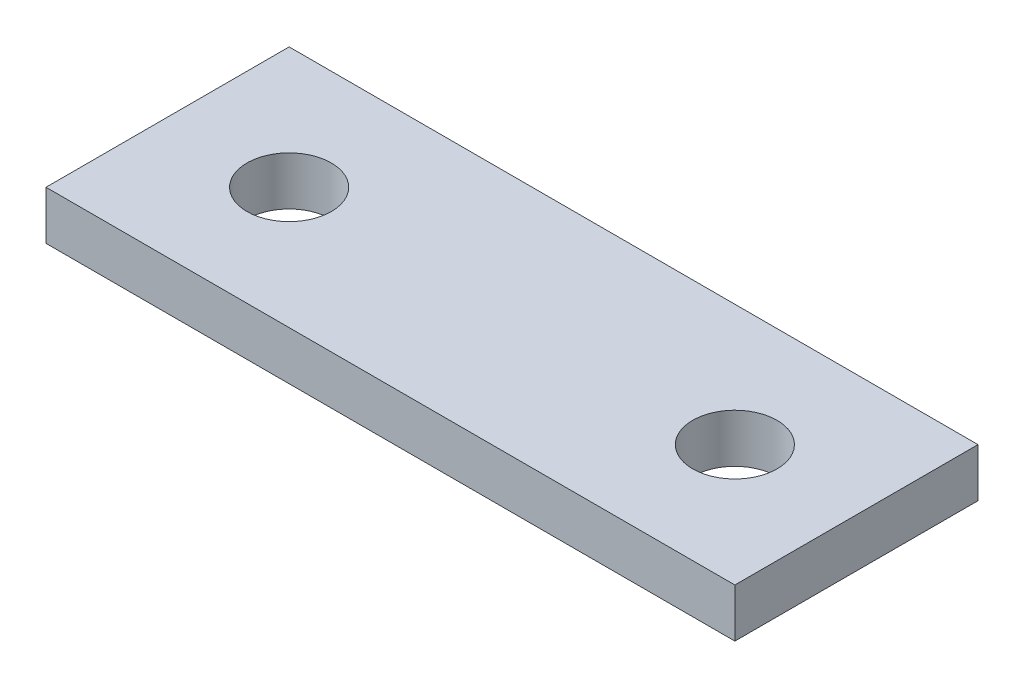
from build123d import *

# Parameters (mm, degrees)
SKETCH_1_W      = 42.5
SKETCH_1_H      = 15
SKETCH_1_R      = 2.6
EXTRUDE_1_DEPTH = 3


with BuildPart() as part:
    # Эскиз1 → Бобышка-Вытянуть1 (new body)
    with BuildSketch(Plane(origin=(0, 0, 0), x_dir=(1, 0, 0), z_dir=(0, 1, 0))):
        Rectangle(SKETCH_1_W, SKETCH_1_H)
        with Locations((13.75, 0)):
            Circle(SKETCH_1_R, mode=Mode.SUBTRACT)
        with Locations((-13.75, 0)):
            Circle(SKETCH_1_R, mode=Mode.SUBTRACT)
    extrude(amount=EXTRUDE_1_DEPTH)


solid = part.part
